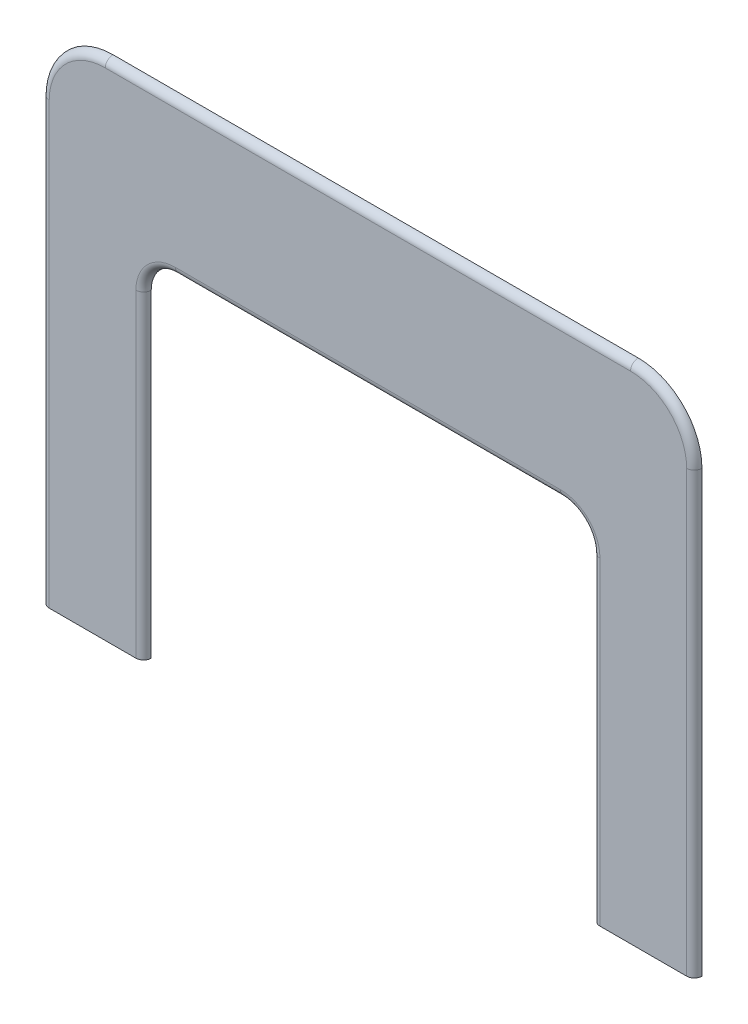
from build123d import *

# Parameters (mm, degrees)
AUFSATZ_LINEAR_AUSTRAGEN1_DEPTH = 1.2
VERRUNDUNG1_R                   = 10
VERRUNDUNG2_R                   = 5
VERRUNDUNG3_R                   = 1.2
VERRUNDUNG4_R                   = 1.2


with BuildPart() as part:
    # Skizze1 → Aufsatz-Linear austragen1 (new body)
    with BuildSketch(Plane.XY):
        Polygon((0, 79), (0, 0), (16, 0), (16, 55), (86.4, 55), (86.4, 0), (102.4, 0), (102.4, 79), align=None)
    extrude(amount=AUFSATZ_LINEAR_AUSTRAGEN1_DEPTH)

    # Verrundung1
    verrundung1_edges = [part.edges().sort_by_distance(p)[0] for p in [
        (0, 79, 0.6),
        (102.4, 79, 0.6),
    ]]
    fillet(verrundung1_edges, radius=VERRUNDUNG1_R)

    # Verrundung2
    verrundung2_edges = [part.edges().sort_by_distance(p)[0] for p in [
        (86.4, 55, 0.6),
        (16, 55, 0.6),
    ]]
    fillet(verrundung2_edges, radius=VERRUNDUNG2_R)

    # Verrundung3
    verrundung3_edges = [part.edges().sort_by_distance(p)[0] for p in [
        (102.4, 34.5, 1.2),
        (99.471067812, 76.071067812, 1.2),
        (51.2, 79, 1.2),
        (2.928932188, 76.071067812, 1.2),
        (0, 34.5, 1.2),
    ]]
    fillet(verrundung3_edges, radius=VERRUNDUNG3_R - 0.0001)  # a hair under: the kernel refuses the full size

    # Verrundung4
    verrundung4_edges = [part.edges().sort_by_distance(p)[0] for p in [
        (16, 25, 1.2),
        (17.464466094, 53.535533906, 1.2),
        (86.4, 25, 1.2),
        (84.935533906, 53.535533906, 1.2),
        (51.2, 55, 1.2),
    ]]
    fillet(verrundung4_edges, radius=VERRUNDUNG4_R - 0.0001)  # a hair under: the kernel refuses the full size


solid = part.part
